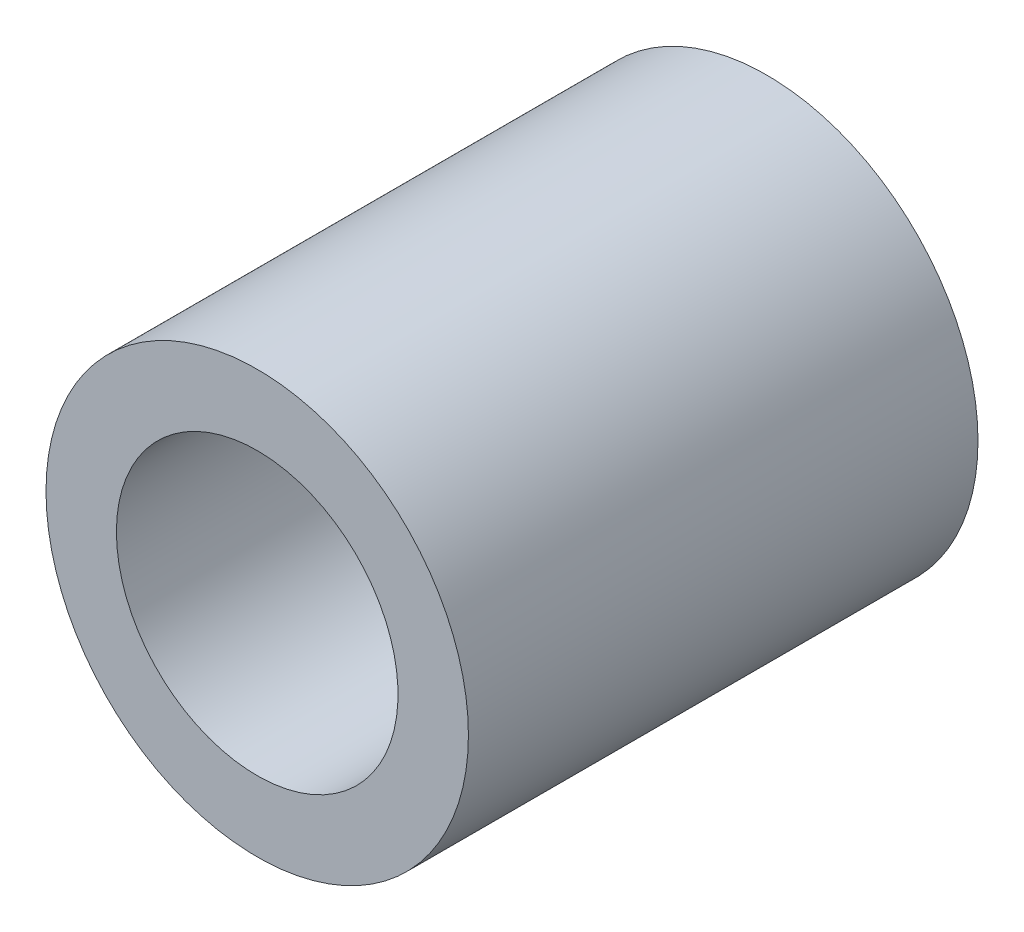
from build123d import *

# Parameters (mm, degrees)
SKETCH1_R           = 4.7625
SKETCH1_R_2         = 3.175
BOSS_EXTRUDE1_DEPTH = 5.745150054


with BuildPart() as part:
    # Sketch1 → Boss-Extrude1 (new, symmetric)
    with BuildSketch(Plane.XY):
        Circle(SKETCH1_R)
        Circle(SKETCH1_R_2, mode=Mode.SUBTRACT)
    extrude(amount=BOSS_EXTRUDE1_DEPTH, both=True)


solid = part.part
